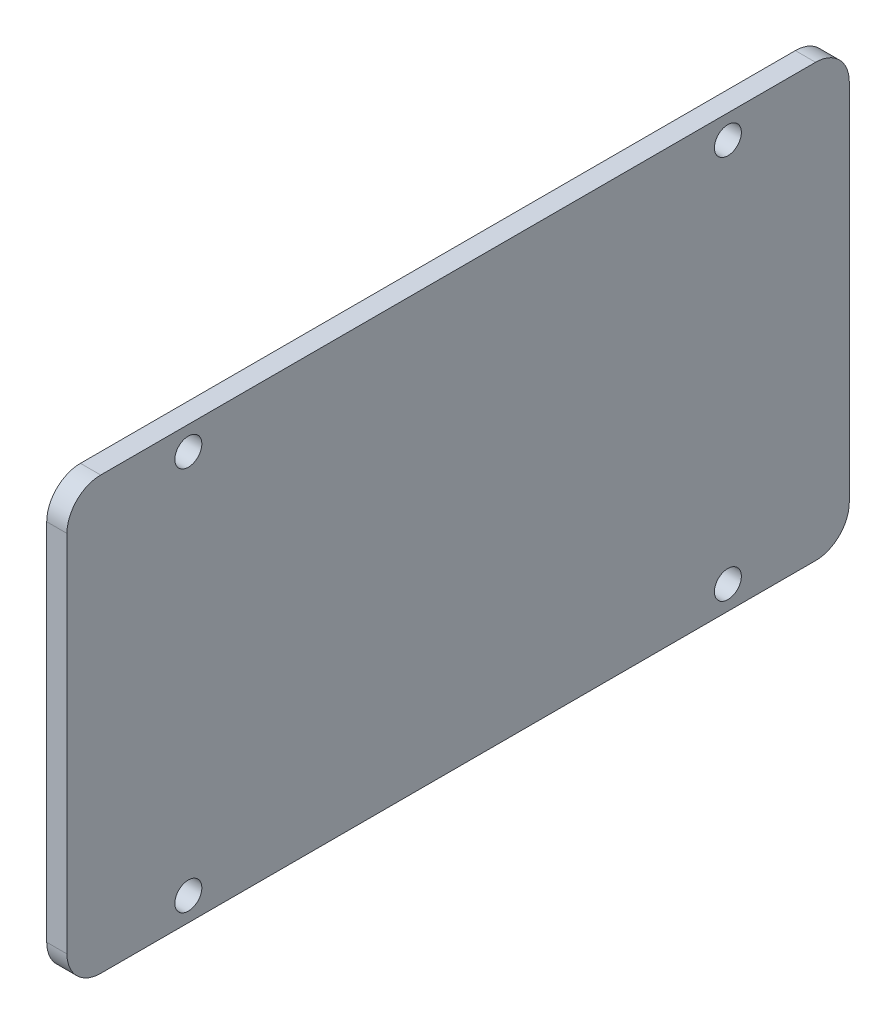
from build123d import *

# Parameters (mm, degrees)
SKETCH1_W          = 3
SKETCH1_H          = 64
BASE_FLANGE1_DEPTH = 116
SKETCH3_R          = 2
CUT_EXTRUDE1_DEPTH = 10
FILLET1_R          = 5


# Sheet-metal steps are written as plain solids
with BuildPart() as part:
    # Sketch1 → Base-Flange1 (new body)
    with BuildSketch(Plane.XY):
        with Locations((1.5, 32)):
            Rectangle(SKETCH1_W, SKETCH1_H)
    extrude(amount=BASE_FLANGE1_DEPTH)

    # Sketch3 → Cut-Extrude1 (cut)
    with BuildSketch(Plane.ZY):
        with Locations((18, 60.5)):
            Circle(SKETCH3_R)
        with Locations((98, 60.5)):
            Circle(SKETCH3_R)
        with Locations((98, 3.5)):
            Circle(SKETCH3_R)
        with Locations((18, 3.5)):
            Circle(SKETCH3_R)
    extrude(amount=-CUT_EXTRUDE1_DEPTH, mode=Mode.SUBTRACT)

    # Fillet1
    fillet1_edges = [part.edges().sort_by_distance(p)[0] for p in [
        (1.5, 0, 116),
        (1.5, 0, 0),
        (1.5, 64, 0),
        (1.5, 64, 116),
    ]]
    fillet(fillet1_edges, radius=FILLET1_R)


solid = part.part
